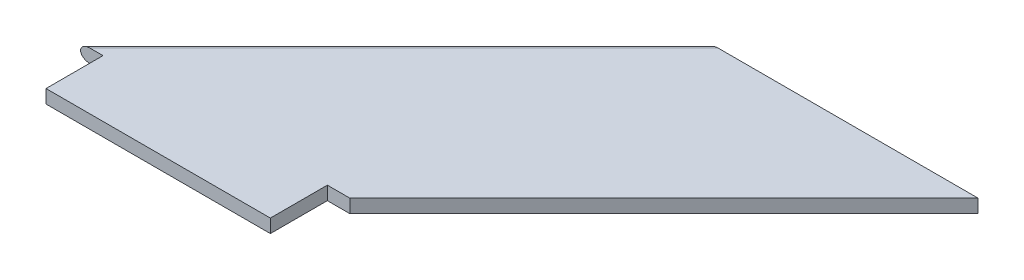
from build123d import *

# Parameters (mm, degrees)
BOSS_EXTRUDE2_DEPTH = 3
FILLET1_R           = 1.5


with BuildPart() as part:
    # Sketch1 → Boss-Extrude2 (new body)
    with BuildSketch(Plane(origin=(0, 0, 0), x_dir=(1, 0, 0), z_dir=(0, 1, 0))):
        Polygon((0, 0), (70, 70), (130, 70), (60, 0), (55, 0), (55, -12.7), (5, -12.7), (5, 0), align=None)
    extrude(amount=BOSS_EXTRUDE2_DEPTH)

    # Fillet1
    fillet1_edges = [part.edges().sort_by_distance(p)[0] for p in [
        (35, 3, -35),
        (35, 0, -35),
    ]]
    fillet(fillet1_edges, radius=FILLET1_R - 0.0001)  # a hair under: the kernel refuses the full size


solid = part.part
